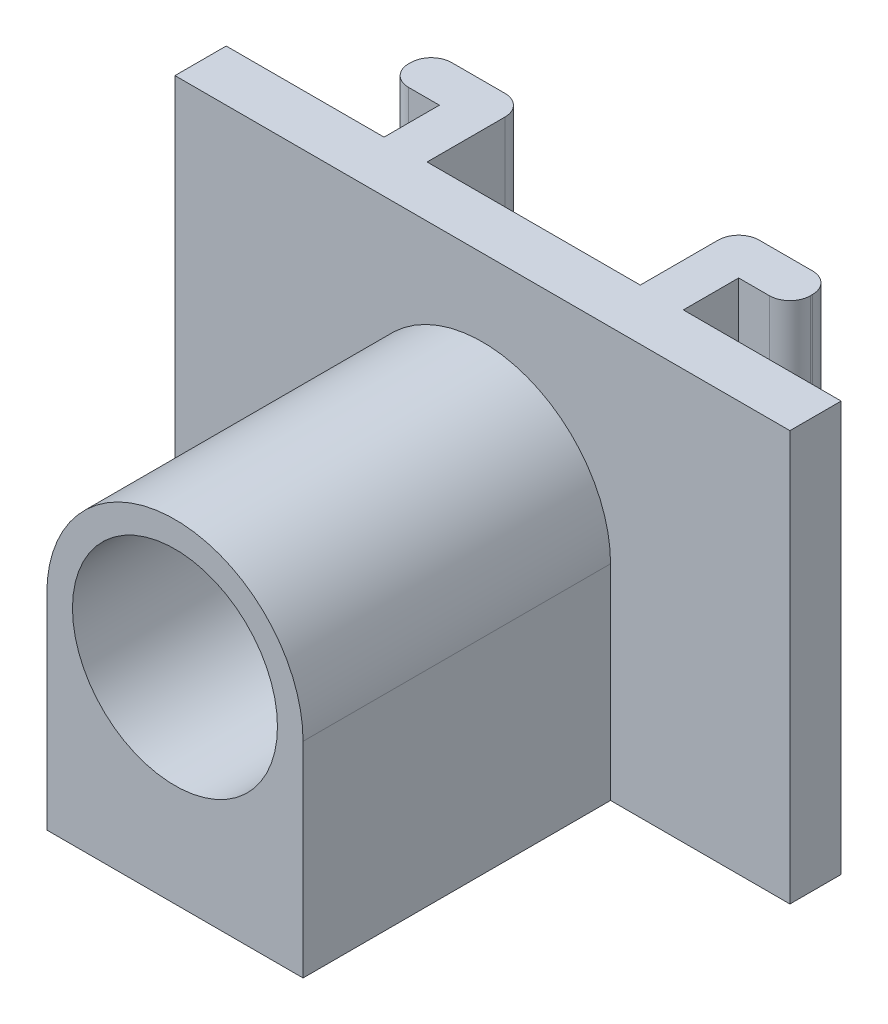
from build123d import *

# Parameters (mm, degrees)
SKETCH1_W           = 38.1
SKETCH1_H           = 25.4
BOSS_EXTRUDE1_DEPTH = 3.175
SKETCH2_W           = 25.4
SKETCH2_H           = 25.4
BOSS_EXTRUDE2_DEPTH = 6.35
CUT_EXTRUDE1_REACH  = 34.379
SKETCH3_W           = 3.175
SKETCH3_H           = 3.175
SKETCH3_W_2         = 6.35
SKETCH3_H_2         = 6.35
CUT_EXTRUDE2_REACH  = 34.379
FILLET1_R           = 1.27
BOSS_EXTRUDE3_DEPTH = 19.05
CUT_EXTRUDE3_REACH  = 38.418
SKETCH6_R           = 6.35


with BuildPart() as part:
    # Sketch1 → Boss-Extrude1 (new body)
    with BuildSketch(Plane.XY):
        Rectangle(SKETCH1_W, SKETCH1_H)
    extrude(amount=BOSS_EXTRUDE1_DEPTH)

    # Sketch2 → Boss-Extrude2 (add)
    with BuildSketch(Plane(origin=(0, 0, 0), x_dir=(-1, 0, 0), z_dir=(0, 0, -1))):
        Rectangle(SKETCH2_W, SKETCH2_H)
    extrude(amount=BOSS_EXTRUDE2_DEPTH)

    # Sketch3 → Cut-Extrude1 (cut, up to next)
    with BuildSketch(Plane(origin=(0, 12.7, 0), x_dir=(1, 0, 0), z_dir=(0, 1, 0)), mode=Mode.PRIVATE) as cut_extrude1_sk1:
        with Locations((11.1125, 1.5875)):
            Rectangle(SKETCH3_W, SKETCH3_H)
    cut_extrude1_tool1 = extrude(cut_extrude1_sk1.sketch, amount=-CUT_EXTRUDE1_REACH, mode=Mode.PRIVATE) & part.part
    # Sketch3 → Cut-Extrude1 (cut, up to next)
    with BuildSketch(Plane(origin=(0, 12.7, 0), x_dir=(1, 0, 0), z_dir=(0, 1, 0)), mode=Mode.PRIVATE) as cut_extrude1_sk2:
        with Locations((3.175, 3.175)):
            Rectangle(SKETCH3_W_2, SKETCH3_H_2)
    cut_extrude1_tool2 = extrude(cut_extrude1_sk2.sketch, amount=-CUT_EXTRUDE1_REACH, mode=Mode.PRIVATE) & part.part
    cut_extrude1_1 = cut_extrude1_tool1.solids().sort_by_distance((11.1125, 12.7, -1.5875))[0]
    add(cut_extrude1_1, mode=Mode.SUBTRACT)
    cut_extrude1_2 = cut_extrude1_tool2.solids().sort_by_distance((3.175, 12.7, -3.175))[0]
    add(cut_extrude1_2, mode=Mode.SUBTRACT)
    cut_extrude1 = cut_extrude1_1 + cut_extrude1_2  # Cut-Extrude1 as one shape, for the pattern or mirror that repeats it

    # Sketch4 → Cut-Extrude2 (cut, up to next)
    with BuildSketch(Plane(origin=(0, 12.7, 0), x_dir=(1, 0, 0), z_dir=(0, 1, 0)), mode=Mode.PRIVATE) as cut_extrude2_sk1:
        Polygon((6.604, 0), (6.35, 0), (6.35, 6.35), (12.7, 6.35), (12.7, 3.175), (9.525, 3.175), (9.525, 0), (9.271, 0), (9.271, 3.429), (12.446, 3.429), (12.446, 6.096), (6.604, 6.096), align=None)
    cut_extrude2_tool1 = extrude(cut_extrude2_sk1.sketch, amount=-CUT_EXTRUDE2_REACH, mode=Mode.PRIVATE) & part.part
    cut_extrude2 = cut_extrude2_tool1.solids().sort_by_distance((6.477, 12.7, -0.089803))[0]
    add(cut_extrude2, mode=Mode.SUBTRACT)

    # Mirror1: Cut-Extrude1, Cut-Extrude2 across plane
    add(cut_extrude1.mirror(Plane.ZY), mode=Mode.SUBTRACT)
    add(cut_extrude2.mirror(Plane.ZY), mode=Mode.SUBTRACT)

    # Fillet1
    fillet1_edges = [part.edges().sort_by_distance(p)[0] for p in [
        (-6.604, 0, -6.096),
        (-12.446, 0, -3.429),
        (-12.446, 0, -6.096),
        (12.446, 0, -3.429),
        (12.446, 0, -6.096),
        (6.604, 0, -6.096),
    ]]
    fillet(fillet1_edges, radius=FILLET1_R)

    # Sketch5 → Boss-Extrude3 (add)
    with BuildSketch(Plane.XY.offset(3.175)):
        with BuildLine():
            Line((7.9375, 0), (7.9375, -12.7))
            Line((7.9375, -12.7), (-7.9375, -12.7))
            Line((-7.9375, -12.7), (-7.9375, 0))
            ThreePointArc((-7.9375, 0), (0, 7.9375), (7.9375, 0))
        make_face()
    extrude(amount=BOSS_EXTRUDE3_DEPTH)

    # Sketch6 → Cut-Extrude3 (cut, up to next)
    with BuildSketch(Plane.XY.offset(22.225), mode=Mode.PRIVATE) as cut_extrude3_sk1:
        Circle(SKETCH6_R)
    cut_extrude3_tool1 = extrude(cut_extrude3_sk1.sketch, amount=-CUT_EXTRUDE3_REACH, mode=Mode.PRIVATE) & part.part
    add(cut_extrude3_tool1.solids().sort_by_distance((0, 0, 22.225))[0], mode=Mode.SUBTRACT)


solid = part.part
